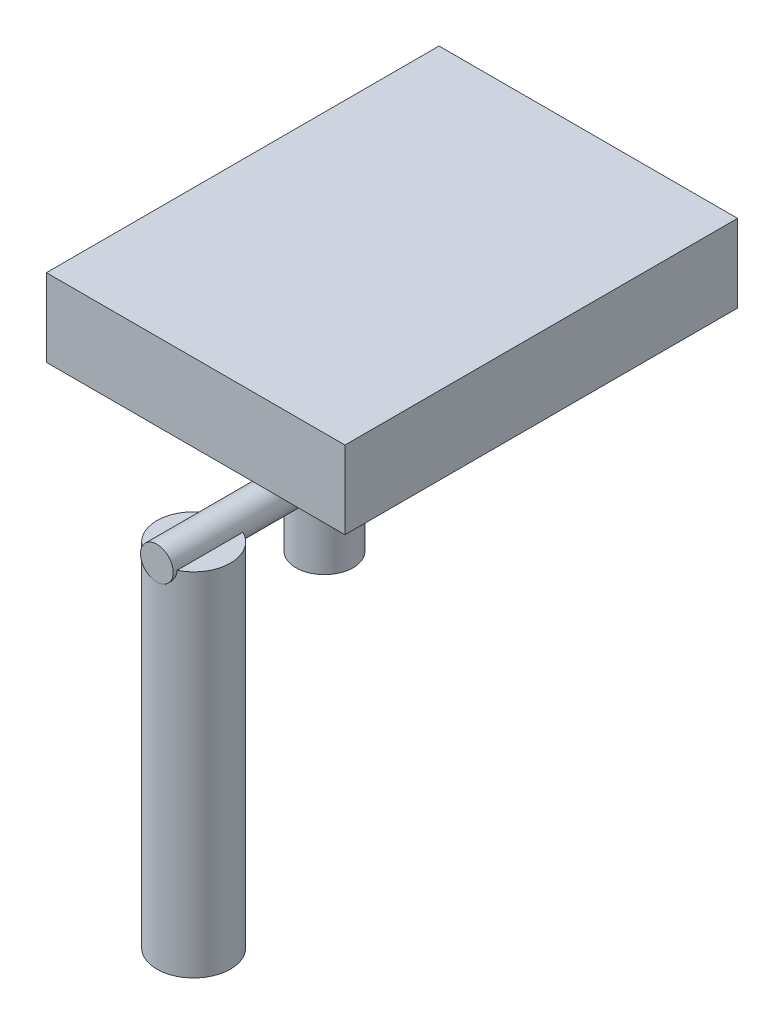
from build123d import *

# Parameters (mm, degrees)
ESQUISSE1_W        = 365
ESQUISSE1_H        = 95
BOSS_EXTRU_1_DEPTH = 480
ESQUISSE3_R        = 35
BOSS_EXTRU_2_DEPTH = 235
BOSS_EXTRU_3_REACH = 632.889
ESQUISSE4_R        = 20
BOSS_EXTRU_4_START = 145
ESQUISSE5_R        = 45
BOSS_EXTRU_4_DEPTH = 430
ESQUISSE6_W        = 170
ESQUISSE6_H        = 70
BOSS_EXTRU_5_DEPTH = 55
ESQUISSE7_R        = 60
BOSS_EXTRU_6_DEPTH = 55


with BuildPart() as part:
    # Esquisse1 → Boss.-Extru.1 (new body)
    with BuildSketch(Plane.XY):
        with Locations((103.348235656, -10.607228484)):
            Rectangle(ESQUISSE1_W, ESQUISSE1_H)
    extrude(amount=BOSS_EXTRU_1_DEPTH)

    # Esquisse3 → Boss.-Extru.2 (add)
    with BuildSketch(Plane.XZ.offset(58.107228484)):
        with Locations((55.848235656, 275)):
            Circle(ESQUISSE3_R)
    extrude(amount=BOSS_EXTRU_2_DEPTH)

    # Esquisse4 → Boss.-Extru.3 (add, up to next)
    with BuildSketch(Plane.XY.offset(480), mode=Mode.PRIVATE) as boss_extru_3_sk1:
        with Locations((55.848235656, -203.107228484)):
            Circle(ESQUISSE4_R)
    boss_extru_3_tool1 = extrude(boss_extru_3_sk1.sketch, amount=-BOSS_EXTRU_3_REACH, mode=Mode.PRIVATE) - part.part
    add(boss_extru_3_tool1.solids().sort_by_distance((55.848236, -203.107228, 480))[0])

    # Esquisse6 → Boss.-Extru.5 (add)
    with BuildSketch(Plane.XZ.offset(58.107228484)):
        with Locations((5.848235656, 275)):
            Rectangle(ESQUISSE6_W, ESQUISSE6_H)
    extrude(amount=BOSS_EXTRU_5_DEPTH)

    # Esquisse7 → Boss.-Extru.6 (add)
    with BuildSketch(Plane.XZ.offset(58.107228484)):
        with Locations((55.848235656, 275)):
            Circle(ESQUISSE7_R)
    extrude(amount=BOSS_EXTRU_6_DEPTH)


with BuildPart() as body_2:
    # Esquisse5 → Boss.-Extru.4 (new body)
    with BuildSketch(Plane.XZ.offset(58.107228484).offset(BOSS_EXTRU_4_START)):
        with Locations((55.848235656, 435)):
            Circle(ESQUISSE5_R)
    extrude(amount=BOSS_EXTRU_4_DEPTH)


solid = Compound([part.part, body_2.part])
